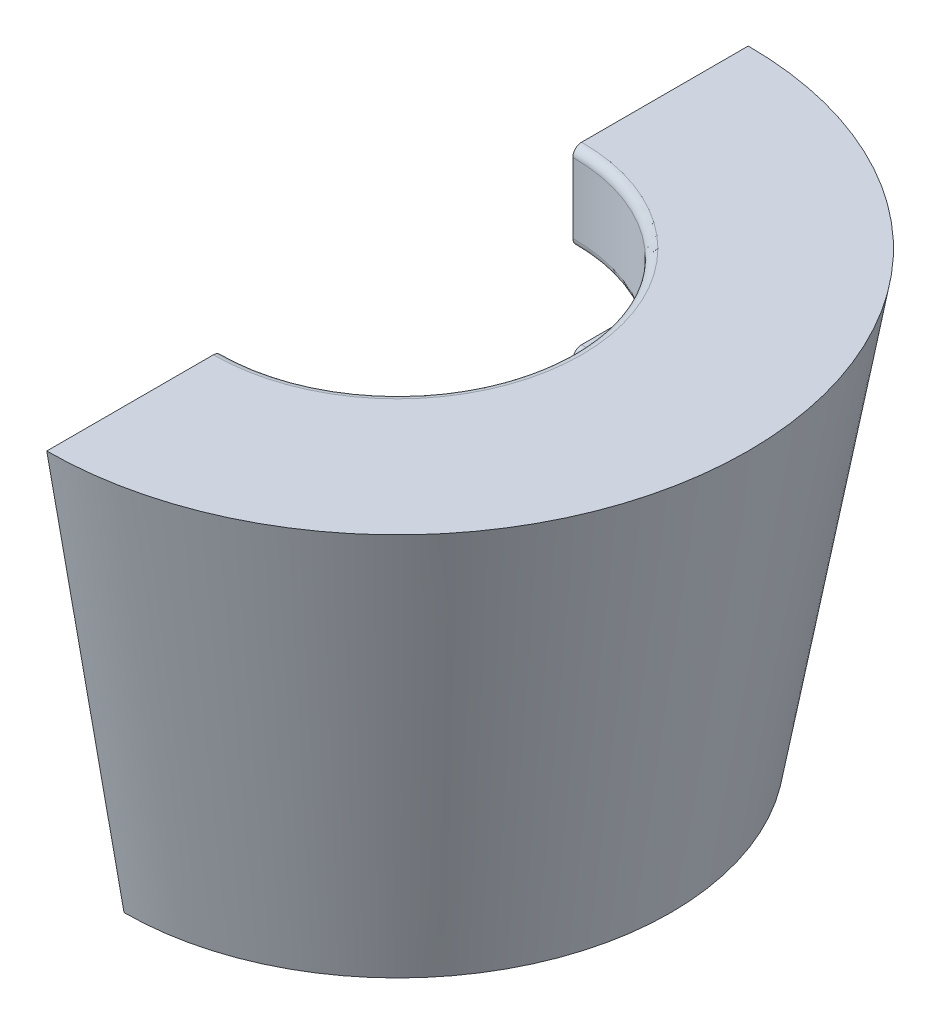
from build123d import *

# Parameters (mm, degrees)
SKETCH1_R           = 4
SKETCH1_R_2         = 3
BOSS_EXTRUDE1_DEPTH = 5
SKETCH2_W           = 1
SKETCH2_H           = 1
FILLET1_R           = 0.1


# Read off the part's stored shape, not the designer's step: Cut-Revolve-Thin1, Body-Delete/Keep 1
with BuildPart() as part:
    # Sketch1 → Boss-Extrude1 (new body)
    with BuildSketch(Plane(origin=(0, 0, 0), x_dir=(1, 0, 0), z_dir=(0, 1, 0))):
        with Locations(Location((0, 0, 0), (0, 0, 270))):
            Circle(SKETCH1_R)
        with Locations(Location((0, 0, 0), (0, 0, 270))):
            Circle(SKETCH1_R_2, mode=Mode.SUBTRACT)
    extrude(amount=BOSS_EXTRUDE1_DEPTH)

    # Sketch2 → Revolve1 (revolve)
    with BuildSketch(Plane.XY, mode=Mode.PRIVATE) as revolve1_sk:
        with Locations((-2.5, 4.5)):
            Rectangle(SKETCH2_W, SKETCH2_H)
        with Locations((-2.5, 2.5)):
            Rectangle(SKETCH2_W, SKETCH2_H)
        with Locations((-2.5, 0.5)):
            Rectangle(SKETCH2_W, SKETCH2_H)
    revolve(revolve1_sk.sketch.rotate(Axis((0, 5, 0), (0, -1, 0)), 270), axis=Axis((0, 5, 0), (0, -1, 0)))

    # Cut-Revolve-Thin1 outline → Cut-Revolve-Thin1 (revolve, cut)
    with BuildSketch(Plane.XY):
        Polygon((3.118365096, 0), (3.219907758, 0), (4, 4.424122952), (4, 5), align=None)
    revolve(axis=Axis((0, 0, 0), (0, 1, 0)), mode=Mode.SUBTRACT)

    # Body-Delete/Keep 1 outline → Body-Delete/Keep 1 (revolve, cut)
    with BuildSketch(Plane.XY):
        Polygon((4, 4.424122952), (3.219907758, 0), (4, 0), align=None)
    revolve(axis=Axis((0, 0, 0), (0, 1, 0)), mode=Mode.SUBTRACT)

    # SurfaceCut1
    split(bisect_by=Plane(origin=(0, 0, 0), x_dir=(0, 0, -1), z_dir=(1, 0, 0)), keep=Keep.TOP)

    # Fillet1
    fillet1_edges = [part.edges().sort_by_distance(p)[0] for p in [
        (2, 0, 0),
        (2, 1, 0),
        (2, 4, 0),
        (2, 5, 0),
        (2, 3, 0),
        (2, 2, 0),
    ]]
    fillet(fillet1_edges, radius=FILLET1_R)


solid = part.part
